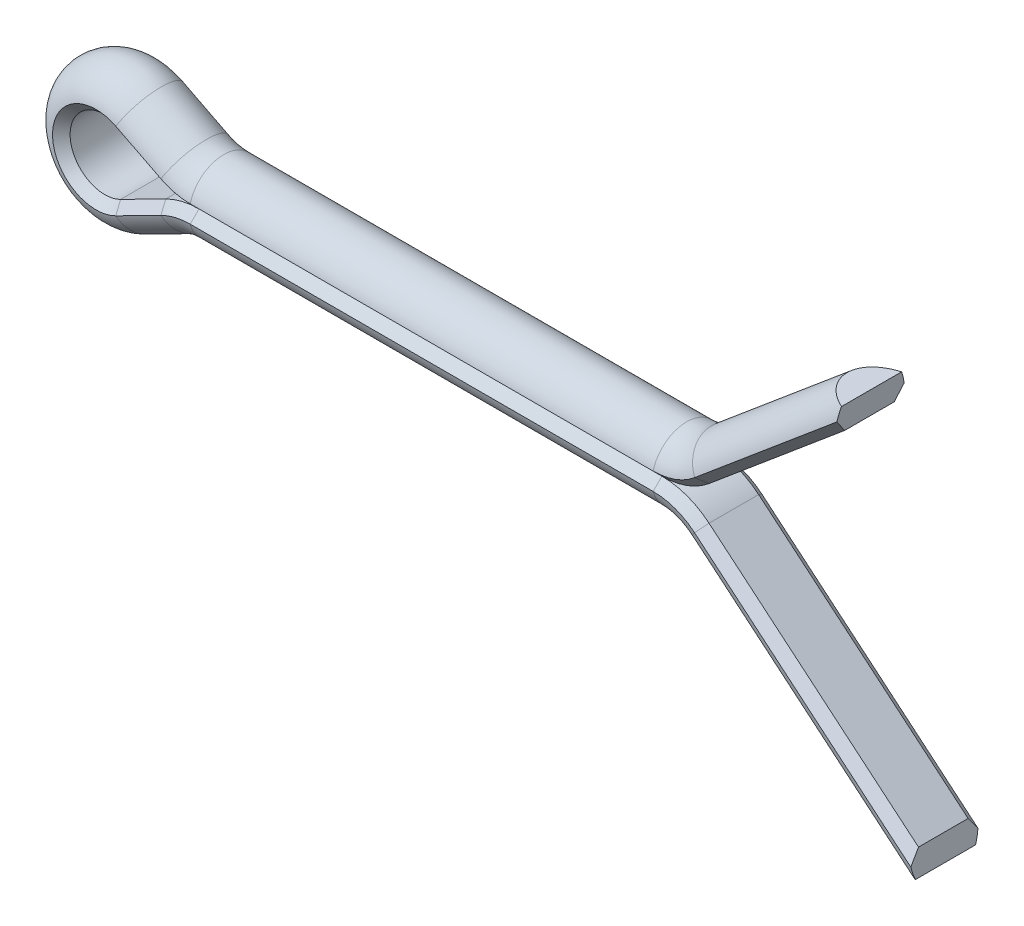
from build123d import *

# Parameters (mm, degrees)
ZKOSIT1_SIZE                  = 0.257142857
ZKOSIT2_SIZE                  = 0.45
ODEBRAT_VYSUNUT_M2_DEPTH      = 10
ODEBRAT_VYSUNUT_M2_DEPTH_BACK = 10
ODEBRAT_VYSUNUT_M3_DEPTH      = 15.066370457
ODEBRAT_VYSUNUT_M3_DEPTH_BACK = 15.066370457


with BuildPart() as part:
    # Táhnout po křivce1: sweep along a path in Skica1
    with BuildLine(Plane.XY) as t_hnout_po_k_ivce1_path:
        Line((10.498702419, 4.371053092), (6.640879802, 1.133955557))
        ThreePointArc((6.640879802, 1.133955557), (6.340112335, 0.960307379), (5.998092192, 0.9))
        Line((5.998092192, 0.9), (-5.998092192, 0.9))
        ThreePointArc((-5.998092192, 0.9), (-6.231322977, 0.927578589), (-6.451689409, 1.008793198))
        Line((-6.451689409, 1.008793198), (-7.621462583, 1.604172244))
        ThreePointArc((-7.621462583, 1.604172244), (-10.237937574, 0), (-7.621462583, -1.604172244))
        Line((-7.621462583, -1.604172244), (-6.451689409, -1.008793198))
        ThreePointArc((-6.451689409, -1.008793198), (-6.231322977, -0.927578589), (-5.998092192, -0.9))
        Line((-5.998092192, -0.9), (5.998092192, -0.9))
        ThreePointArc((5.998092192, -0.9), (6.340112335, -0.960307379), (6.640879802, -1.133955557))
        Line((6.640879802, -1.133955557), (10.498702419, -4.371053092))
        Line((10.498702419, -4.371053092), (12.413813527, -5.978022117))
    # Skica2 → Táhnout po křivce1 (sweep)
    with BuildSketch(Plane(origin=(10.498702419, 4.371053092, 0), x_dir=(0, 0, -1), z_dir=(0.7660444431189762, 0.6427876096865417, 0))):
        with BuildLine():
            Line((0.9, -0.9), (-0.9, -0.9))
            ThreePointArc((-0.9, -0.9), (0, 0), (0.9, -0.9))
        make_face()
    sweep(path=t_hnout_po_k_ivce1_path.line)

    # Zkosit1
    # the kernel refuses this chamfer: 0.257142857 mm, written as the material it takes off along each edge
    with BuildSketch(Plane(origin=(5.998092192, 0, 0.9), x_dir=(0, 0, -1), z_dir=(-1, 0, 0)), Plane(origin=(-5.998092192, 0, 0.9), x_dir=(0, 0, -1), z_dir=(1, 0, 0))) as zkosit1_piece_1:
        with BuildLine():
            Line((ZKOSIT1_SIZE, 0), (0.029314045, -0.227828812))
            ThreePointArc((0.029314045, -0.227828812), (0.007766605, -0.117981219), (0, 0))
            Line((0, 0), (ZKOSIT1_SIZE, 0))
        make_face()
    extrude(amount=11.996184384, mode=Mode.SUBTRACT)
    with BuildSketch(Plane(origin=(5.998092192, 0, -0.9), x_dir=(0, 0, 1), z_dir=(-1, 0, 0)), Plane(origin=(-5.998092192, 0, -0.9), x_dir=(0, 0, 1), z_dir=(1, 0, 0))) as zkosit1_piece_2:
        with BuildLine():
            Line((ZKOSIT1_SIZE, 0), (0.029314045, 0.227828812))
            ThreePointArc((0.029314045, 0.227828812), (0.007766605, 0.117981219), (0, 0))
            Line((0, 0), (ZKOSIT1_SIZE, 0))
        make_face()
    extrude(amount=11.996184384, mode=Mode.SUBTRACT)
    with BuildSketch(Plane(origin=(-5.998092192, 1.9, 0.9), x_dir=(0, -1, 0), z_dir=(1, 0, 0))) as zkosit1_piece_3:
        with BuildLine():
            Line((1.9, ZKOSIT1_SIZE), (1.672171188, 0.029314045))
            ThreePointArc((1.672171188, 0.029314045), (1.782018781, 0.007766605), (1.9, 0))
            Line((1.9, 0), (1.9, ZKOSIT1_SIZE))
        make_face()
    revolve(axis=Axis((-5.998092192, 1.9, 0.9), (0, 0, -1)), revolution_arc=26.974712985, mode=Mode.SUBTRACT)
    with BuildSketch(Plane(origin=(-5.998092192, 1.9, -0.9), x_dir=(0, -1, 0), z_dir=(1, 0, 0))) as zkosit1_piece_4:
        with BuildLine():
            Line((1.9, -ZKOSIT1_SIZE), (1.672171188, -0.029314045))
            ThreePointArc((1.672171188, -0.029314045), (1.782018781, -0.007766605), (1.9, 0))
            Line((1.9, 0), (1.9, -ZKOSIT1_SIZE))
        make_face()
    revolve(axis=Axis((-5.998092192, 1.9, -0.9), (0, 0, -1)), revolution_arc=26.974712985, mode=Mode.SUBTRACT)
    with BuildSketch(Plane(origin=(-6.859926905, 0.206707076, 0.9), x_dir=(0, 0, -1), z_dir=(-0.8912068023322748, 0.4535972172276652, 0)), Plane(origin=(-8.029700078, -0.802086122, 0.9), x_dir=(0, 0, -1), z_dir=(0.8912068023322748, 0.45359721722766544, 0))) as zkosit1_piece_5:
        with BuildLine():
            Line((ZKOSIT1_SIZE, 0), (0.029314045, -0.227828812))
            ThreePointArc((0.029314045, -0.227828812), (0.007766605, -0.117981219), (0, 0))
            Line((0, 0), (ZKOSIT1_SIZE, 0))
        make_face()
    extrude(amount=1.312572088, mode=Mode.SUBTRACT)
    with BuildSketch(Plane(origin=(-6.859926905, 0.206707076, -0.9), x_dir=(0, 0, 1), z_dir=(-0.8912068023322748, 0.4535972172276652, 0)), Plane(origin=(-8.029700078, -0.802086122, -0.9), x_dir=(0, 0, 1), z_dir=(0.8912068023322748, 0.45359721722766544, 0))) as zkosit1_piece_6:
        with BuildLine():
            Line((ZKOSIT1_SIZE, 0), (0.029314045, 0.227828812))
            ThreePointArc((0.029314045, 0.227828812), (0.007766605, 0.117981219), (0, 0))
            Line((0, 0), (ZKOSIT1_SIZE, 0))
        make_face()
    extrude(amount=1.312572088, mode=Mode.SUBTRACT)
    with BuildSketch(Plane(origin=(-8.437937574, 0, 0.9), x_dir=(0.4535972172277306, 0.8912068023322415, 0), z_dir=(0.8912068023322415, -0.4535972172277306, 0))) as zkosit1_piece_7:
        with BuildLine():
            Line((0.9, -ZKOSIT1_SIZE), (1.127828812, -0.029314045))
            ThreePointArc((1.127828812, -0.029314045), (1.017981219, -0.007766605), (0.9, 0))
            Line((0.9, 0), (0.9, -ZKOSIT1_SIZE))
        make_face()
    revolve(axis=Axis((-8.437937574, 0, 0.9), (0, 0, 1)), revolution_arc=233.94942597, mode=Mode.SUBTRACT)
    with BuildSketch(Plane(origin=(-8.437937574, 0, -0.9), x_dir=(0.4535972172277306, 0.8912068023322415, 0), z_dir=(0.8912068023322415, -0.4535972172277306, 0))) as zkosit1_piece_8:
        with BuildLine():
            Line((0.9, ZKOSIT1_SIZE), (1.127828812, 0.029314045))
            ThreePointArc((1.127828812, 0.029314045), (1.017981219, 0.007766605), (0.9, 0))
            Line((0.9, 0), (0.9, ZKOSIT1_SIZE))
        make_face()
    revolve(axis=Axis((-8.437937574, 0, -0.9), (0, 0, 1)), revolution_arc=233.94942597, mode=Mode.SUBTRACT)
    with BuildSketch(Plane(origin=(-5.998092192, -1.9, 0.9), x_dir=(-0.4535972172277067, 0.8912068023322537, 0), z_dir=(-0.8912068023322537, -0.4535972172277067, 0))) as zkosit1_piece_9:
        with BuildLine():
            Line((1.9, ZKOSIT1_SIZE), (1.672171188, 0.029314045))
            ThreePointArc((1.672171188, 0.029314045), (1.782018781, 0.007766605), (1.9, 0))
            Line((1.9, 0), (1.9, ZKOSIT1_SIZE))
        make_face()
    revolve(axis=Axis((-5.998092192, -1.9, 0.9), (0, 0, -1)), revolution_arc=26.974712985, mode=Mode.SUBTRACT)
    with BuildSketch(Plane(origin=(-5.998092192, -1.9, -0.9), x_dir=(-0.4535972172277067, 0.8912068023322537, 0), z_dir=(-0.8912068023322537, -0.4535972172277067, 0))) as zkosit1_piece_10:
        with BuildLine():
            Line((1.9, -ZKOSIT1_SIZE), (1.672171188, -0.029314045))
            ThreePointArc((1.672171188, -0.029314045), (1.782018781, -0.007766605), (1.9, 0))
            Line((1.9, 0), (1.9, -ZKOSIT1_SIZE))
        make_face()
    revolve(axis=Axis((-5.998092192, -1.9, -0.9), (0, 0, -1)), revolution_arc=26.974712985, mode=Mode.SUBTRACT)
    with BuildSketch(Plane(origin=(5.998092192, -1.9, 0.9), x_dir=(0, 1, 0), z_dir=(-1, 0, 0))) as zkosit1_piece_11:
        with BuildLine():
            Line((1.9, ZKOSIT1_SIZE), (1.672171188, 0.029314045))
            ThreePointArc((1.672171188, 0.029314045), (1.782018781, 0.007766605), (1.9, 0))
            Line((1.9, 0), (1.9, ZKOSIT1_SIZE))
        make_face()
    revolve(axis=Axis((5.998092192, -1.9, 0.9), (0, 0, -1)), revolution_arc=40, mode=Mode.SUBTRACT)
    with BuildSketch(Plane(origin=(5.998092192, -1.9, -0.9), x_dir=(0, 1, 0), z_dir=(-1, 0, 0))) as zkosit1_piece_12:
        with BuildLine():
            Line((1.9, -ZKOSIT1_SIZE), (1.672171188, -0.029314045))
            ThreePointArc((1.672171188, -0.029314045), (1.782018781, -0.007766605), (1.9, 0))
            Line((1.9, 0), (1.9, -ZKOSIT1_SIZE))
        make_face()
    revolve(axis=Axis((5.998092192, -1.9, -0.9), (0, 0, -1)), revolution_arc=40, mode=Mode.SUBTRACT)
    with BuildSketch(Plane(origin=(7.21938865, -0.444515558, 0.9), x_dir=(0, 0, -1), z_dir=(0.7660444431189773, -0.6427876096865403, 0)), Plane(origin=(13.498899837, -5.713651079, -0.9), x_dir=(0, 0, 1), z_dir=(-0.7660444431189773, 0.6427876096865401, 0))) as zkosit1_piece_13:
        with BuildLine():
            Line((ZKOSIT1_SIZE, 0), (0.029314045, -0.227828812))
            ThreePointArc((0.029314045, -0.227828812), (0.007766605, -0.117981219), (0, 0))
            Line((0, 0), (ZKOSIT1_SIZE, 0))
        make_face()
    extrude(amount=8.197319677, mode=Mode.SUBTRACT)
    with BuildSketch(Plane(origin=(11.58378873, 4.106682055, -0.9), x_dir=(0, 0, 1), z_dir=(-0.766044443118977, -0.6427876096865406, 0))) as zkosit1_piece_14:
        with BuildLine():
            Line((ZKOSIT1_SIZE, 0), (0.029314045, 0.227828812))
            ThreePointArc((0.029314045, 0.227828812), (0.007766605, 0.117981219), (0, 0))
            Line((0, 0), (ZKOSIT1_SIZE, 0))
        make_face()
    extrude(amount=5.697319677, mode=Mode.SUBTRACT)
    with BuildSketch(Plane(origin=(11.58378873, 4.106682055, 0.9), x_dir=(0, 0, -1), z_dir=(-0.766044443118977, -0.6427876096865406, 0))) as zkosit1_piece_15:
        with BuildLine():
            Line((ZKOSIT1_SIZE, 0), (0.029314045, -0.227828812))
            ThreePointArc((0.029314045, -0.227828812), (0.007766605, -0.117981219), (0, 0))
            Line((0, 0), (ZKOSIT1_SIZE, 0))
        make_face()
    extrude(amount=5.697319677, mode=Mode.SUBTRACT)
    with BuildSketch(Plane(origin=(5.998092192, 1.9, 0.9), x_dir=(0.6427876096865431, -0.7660444431189749, 0), z_dir=(0.7660444431189749, 0.6427876096865431, 0))) as zkosit1_piece_16:
        with BuildLine():
            Line((1.9, ZKOSIT1_SIZE), (1.672171188, 0.029314045))
            ThreePointArc((1.672171188, 0.029314045), (1.782018781, 0.007766605), (1.9, 0))
            Line((1.9, 0), (1.9, ZKOSIT1_SIZE))
        make_face()
    revolve(axis=Axis((5.998092192, 1.9, 0.9), (0, 0, -1)), revolution_arc=40, mode=Mode.SUBTRACT)
    with BuildSketch(Plane(origin=(5.998092192, 1.9, -0.9), x_dir=(0.6427876096865431, -0.7660444431189749, 0), z_dir=(0.7660444431189749, 0.6427876096865431, 0))) as zkosit1_piece_17:
        with BuildLine():
            Line((1.9, -ZKOSIT1_SIZE), (1.672171188, -0.029314045))
            ThreePointArc((1.672171188, -0.029314045), (1.782018781, -0.007766605), (1.9, 0))
            Line((1.9, 0), (1.9, -ZKOSIT1_SIZE))
        make_face()
    revolve(axis=Axis((5.998092192, 1.9, -0.9), (0, 0, -1)), revolution_arc=40, mode=Mode.SUBTRACT)

    # Zkosit2
    zkosit2_edges = [part.edges().sort_by_distance(p)[0] for p in [
        (12.992322376, -5.288582118, 0),
        (11.077211268, 3.681613094, 0),
    ]]
    chamfer(zkosit2_edges, length=ZKOSIT2_SIZE)

    # Skica5 → Odebrat vysunutím2 (cut, two sides: drawn at the far end of the back side and taken through both)
    with BuildSketch(Plane.XY.offset(-ODEBRAT_VYSUNUT_M2_DEPTH_BACK)):
        Polygon((10.787956844, 4.026333093), (10.15398242, 4.081798668), (10.498702419, 4.371053092), align=None)
    extrude(amount=ODEBRAT_VYSUNUT_M2_DEPTH + ODEBRAT_VYSUNUT_M2_DEPTH_BACK, mode=Mode.SUBTRACT)

    # Skica6 → Odebrat vysunutím3 (cut, two sides: drawn at the far end of the back side and taken through both)
    with BuildSketch(Plane.XY.offset(-ODEBRAT_VYSUNUT_M3_DEPTH_BACK)):
        Polygon((12.703067951, -5.633302117), (12.069093528, -5.688767692), (12.413813527, -5.978022117), align=None)
    extrude(amount=ODEBRAT_VYSUNUT_M3_DEPTH + ODEBRAT_VYSUNUT_M3_DEPTH_BACK, mode=Mode.SUBTRACT)


solid = part.part
